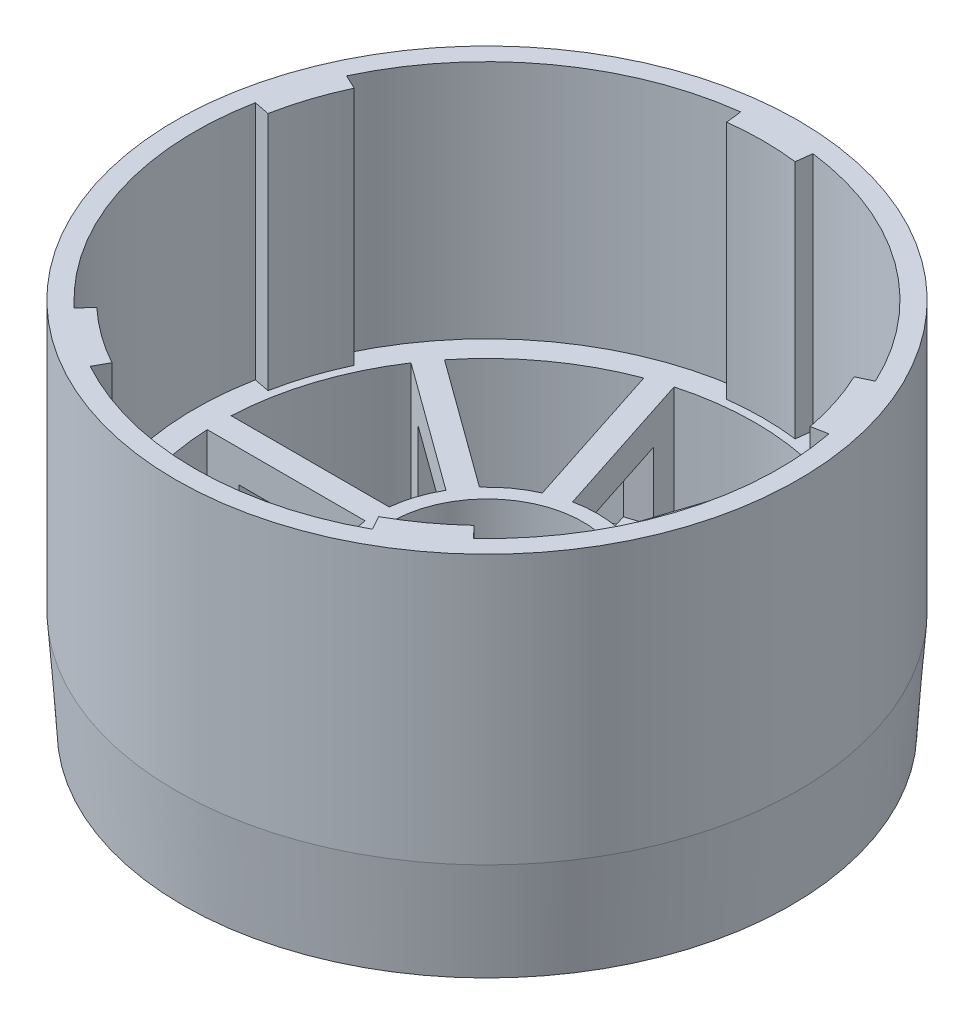
from build123d import *

# Parameters (mm, degrees)
BOSS_EXTRUDE1_DEPTH    = 16.5
SKETCH1_3_R            = 38
BOSS_EXTRUDE2_DEPTH    = 29.5
CHAMFER1_SIZE          = 1
CUT_EXTRUDE1_DEPTH     = 4.5
SKETCH3_R              = 12
CUT_EXTRUDE2_DEPTH     = 9
SKETCH4_R              = 4.15
CUT_EXTRUDE3_DEPTH     = 57.216100896
SKETCH5_R              = 33.5
SKETCH5_R_2            = 13.8
CUT_EXTRUDE4_DEPTH     = 57.216100896
SKETCH8_W              = 8.3
SKETCH8_H              = 8.3
BOSS_EXTRUDE5_DEPTH    = 0.4
BOSS_EXTRUDE6_DEPTH    = 16.5
SKETCH6_W              = 11.748165023
SKETCH6_H              = 8.5
CUT_EXTRUDE5_DEPTH     = 3
CIRPATTERN1_COUNT      = 10
CIRPATTERN1_2_COUNT    = 10
INTERSECT1_START       = 16.5
INTERSECT1_OUTLINE_R   = 38
INTERSECT1_OUTLINE_R_2 = 35
INTERSECT1_DEPTH       = 13
SKETCH9_R              = 38.9
SKETCH9_R_2            = 36.5
ADAPTER_WALL_DEPTH     = 30
GROOVE_DEPTH           = 30
CIRPATTERN2_COUNT      = 5


# Read off the part's stored shape, not the designer's step: Intersect1, Draft4
with BuildPart() as part:
    # Sketch1 → Boss-Extrude1 (new body)
    with BuildSketch(Plane(origin=(0, 0, 0), x_dir=(1, 0, 0), z_dir=(0, 1, 0))):
        with BuildLine():
            ThreePointArc((-35, 0), (-23.807565896, -25.655405007), (2.611417491, -34.902442589))
            ThreePointArc((2.611417491, -34.902442589), (25.1391934, -24.352021583), (34.967837614, -1.50011086))
            ThreePointArc((34.967837614, -1.50011086), (26.159850954, 23.252143945), (2.611487723, 34.902437334))
            ThreePointArc((2.611487723, 34.902437334), (-23.807540084, 25.65542896), (-35, 0))
        make_face()
        with BuildLine():
            Line((-2.610578379, 3.226047199), (0, 3.226047199))
            Line((0, 3.226047199), (2.610578379, 3.226047199))
            ThreePointArc((2.610578379, 3.226047199), (0, -4.15), (-2.610578379, 3.226047199))
        make_face(mode=Mode.SUBTRACT)
    extrude(amount=BOSS_EXTRUDE1_DEPTH)

    # Sketch1<3> → Boss-Extrude2 (add)
    with BuildSketch(Plane(origin=(0, 0, 0), x_dir=(1, 0, 0), z_dir=(0, 1, 0))):
        with Locations(Location((0, 0, 0), (0, 0, 270))):
            Circle(SKETCH1_3_R)
        with BuildLine():
            ThreePointArc((34.967837614, -1.50011086), (25.1391934, -24.352021583), (2.611417491, -34.902442589))
            ThreePointArc((2.611417491, -34.902442589), (-23.807565896, -25.655405007), (-35, 0))
            ThreePointArc((-35, 0), (-23.807540084, 25.65542896), (2.611487723, 34.902437334))
            ThreePointArc((2.611487723, 34.902437334), (25.65542896, 23.807540084), (35, 0))
            ThreePointArc((35, 0), (34.99195848, -0.7502278), (34.967837614, -1.50011086))
        make_face(mode=Mode.SUBTRACT)
    extrude(amount=BOSS_EXTRUDE2_DEPTH)

    # Chamfer1
    chamfer1_edges = [part.edges().sort_by_distance(p)[0] for p in [
        (0, 0, -3.226047199),
        (0, 0, 4.15),
    ]]
    chamfer(chamfer1_edges, length=CHAMFER1_SIZE)

    # Sketch2 → Cut-Extrude1 (cut)
    with BuildSketch(Plane.XZ):
        Polygon((-3.75277675, 6.5), (-7.505553499, 0), (-3.75277675, -6.5), (3.75277675, -6.5), (7.505553499, 0), (3.75277675, 6.5), align=None)
    extrude(amount=-CUT_EXTRUDE1_DEPTH, mode=Mode.SUBTRACT)

    # Sketch3 → Cut-Extrude2 (cut)
    with BuildSketch(Plane(origin=(0, 16.5, 0), x_dir=(1, 0, 0), z_dir=(0, 1, 0))):
        with Locations(Location((0, 0, 0), (0, 0, 270))):
            Circle(SKETCH3_R)
    extrude(amount=-CUT_EXTRUDE2_DEPTH, mode=Mode.SUBTRACT)

    # Sketch4 → Cut-Extrude3 (cut, through all)
    with BuildSketch(Plane(origin=(0, 16.5, 0), x_dir=(1, 0, 0), z_dir=(0, 1, 0))):
        with Locations(Location((0, 0, 0), (0, 0, 90))):
            Circle(SKETCH4_R)
    extrude(amount=-CUT_EXTRUDE3_DEPTH, mode=Mode.SUBTRACT)

    # Sketch5 → Cut-Extrude4 (cut, through all)
    with BuildSketch(Plane(origin=(0, 16.5, 0), x_dir=(1, 0, 0), z_dir=(0, 1, 0))):
        with Locations(Location((0, 0, 0), (0, 0, 270))):
            Circle(SKETCH5_R)
        with Locations(Location((0, 0, 0), (0, 0, 270))):
            Circle(SKETCH5_R_2, mode=Mode.SUBTRACT)
    extrude(amount=-CUT_EXTRUDE4_DEPTH, mode=Mode.SUBTRACT)


with BuildPart() as cut_extrude4_piece_1:
    # of the separate pieces the step leaves, piece 1, a body of its own (cut_extrude4_pieces)
    add(part.part.solids().sort_by_distance((0, 0, 38))[0])

    # Sketch5<3> → Boss-Extrude6 (add)
    with BuildSketch(Plane(origin=(0, 16.5, 0), x_dir=(1, 0, 0), z_dir=(0, 1, 0))):
        with BuildLine():
            Line((33.5, 0), (13.8, 0))
            ThreePointArc((13.8, 0), (13.779543848, -0.751113398), (13.718236038, -1.5))
            Line((13.718236038, -1.5), (33.466401061, -1.5))
            ThreePointArc((33.466401061, -1.5), (33.491599212, -0.750188125), (33.5, 0))
        make_face()
        with BuildLine():
            ThreePointArc((13.718236038, 1.5), (13.779543848, 0.751113398), (13.8, 0))
            Line((13.8, 0), (33.5, 0))
            ThreePointArc((33.5, 0), (33.491599212, 0.750188125), (33.466401061, 1.5))
            Line((33.466401061, 1.5), (13.718236038, 1.5))
        make_face()
    boss_extrude6 = extrude(amount=-BOSS_EXTRUDE6_DEPTH)

    # Sketch6 → Cut-Extrude5 (cut)
    with BuildSketch(Plane(origin=(-0.880879479, 0, -1.5), x_dir=(-1, 0, 0), z_dir=(0, 0, -1))):
        with Locations((-24.473198029, 8.25)):
            Rectangle(SKETCH6_W, SKETCH6_H)
    cut_extrude5 = extrude(amount=-CUT_EXTRUDE5_DEPTH, mode=Mode.SUBTRACT)

    # CirPattern1: Boss-Extrude6 ×10 about axis
    cirpattern1_axis = Axis((0, 0, 0), (0, 1, 0))
    for i in range(1, CIRPATTERN1_COUNT):
        add(boss_extrude6.rotate(cirpattern1_axis, i * 360 / CIRPATTERN1_COUNT))

    # CirPattern1 2: Cut-Extrude5 ×10 about axis
    cirpattern1_2_axis = Axis((0, 0, 0), (0, 1, 0))
    for i in range(1, CIRPATTERN1_2_COUNT):
        add(cut_extrude5.rotate(cirpattern1_2_axis, i * 360 / CIRPATTERN1_2_COUNT), mode=Mode.SUBTRACT)

    # Intersect1 outline → Intersect1 (cut)
    with BuildSketch(Plane(origin=(0, 0, 0), x_dir=(1, 0, 0), z_dir=(0, 1, 0)).offset(INTERSECT1_START)):
        Circle(INTERSECT1_OUTLINE_R)
        Circle(INTERSECT1_OUTLINE_R_2, mode=Mode.SUBTRACT)
    extrude(amount=INTERSECT1_DEPTH, mode=Mode.SUBTRACT)


with BuildPart() as cut_extrude4_piece_2:
    # of the separate pieces the step leaves, piece 2, a body of its own (cut_extrude4_pieces)
    add(part.part.solids().sort_by_distance((2.610578379, 4.5, -3.226047199))[0])


    add(cut_extrude4_piece_1.part)  # Adapter_Wall merges Cut-Extrude4 piece 1
    # Sketch9 → Adapter_Wall (add)
    with BuildSketch(Plane(origin=(0, 46.5, 0), x_dir=(1, 0, 0), z_dir=(0, 1, 0))):
        with Locations(Location((0, 0, 0), (0, 0, 270))):
            Circle(SKETCH9_R)
        with Locations(Location((0, 0, 0), (0, 0, 270))):
            Circle(SKETCH9_R_2, mode=Mode.SUBTRACT)
    extrude(amount=-ADAPTER_WALL_DEPTH)

    # Sketch9<3> → Groove (add)
    with BuildSketch(Plane(origin=(0, 46.5, 0), x_dir=(1, 0, 0), z_dir=(0, 1, 0))):
        with BuildLine():
            ThreePointArc((4.521096859, 36.218913335), (0, 36.5), (-4.521096859, 36.218913335))
            Line((-4.521096859, 36.218913335), (-4.273365524, 34.234315344))
            ThreePointArc((-4.273365524, 34.234315344), (0, 34.5), (4.273365524, 34.234315344))
            Line((4.273365524, 34.234315344), (4.521096859, 36.218913335))
        make_face()
    groove = extrude(amount=-GROOVE_DEPTH)

    # CirPattern2: Groove ×5 about axis
    cirpattern2_axis = Axis((0, 0, 0), (0, 1, 0))
    for i in range(1, CIRPATTERN2_COUNT):
        add(groove.rotate(cirpattern2_axis, i * 360 / CIRPATTERN2_COUNT))

    # Draft4 outline → Draft4 (revolve)
    with BuildSketch(Plane.XY):
        Polygon((38, 16.5), (38, 0), (38.9, 12.870599631), (38.9, 16.5), align=None)
    revolve(axis=Axis((0, 0, 0), (0, 1, 0)))


with BuildPart() as body_3:
    # Sketch8 → Boss-Extrude5 (new body)
    with BuildSketch(Plane.XZ.offset(-4.5)):
        Polygon((4.070319398, -5.95), (5.95, -2.694297695), (5.95, 2.694297695), (4.070319398, 5.95), (-4.070319398, 5.95), (-5.95, 2.694297695), (-5.95, -2.694297695), (-4.070319398, -5.95), align=None)
        Rectangle(SKETCH8_W, SKETCH8_H, mode=Mode.SUBTRACT)
    extrude(amount=BOSS_EXTRUDE5_DEPTH)


solid = Compound([cut_extrude4_piece_2.part, body_3.part])
